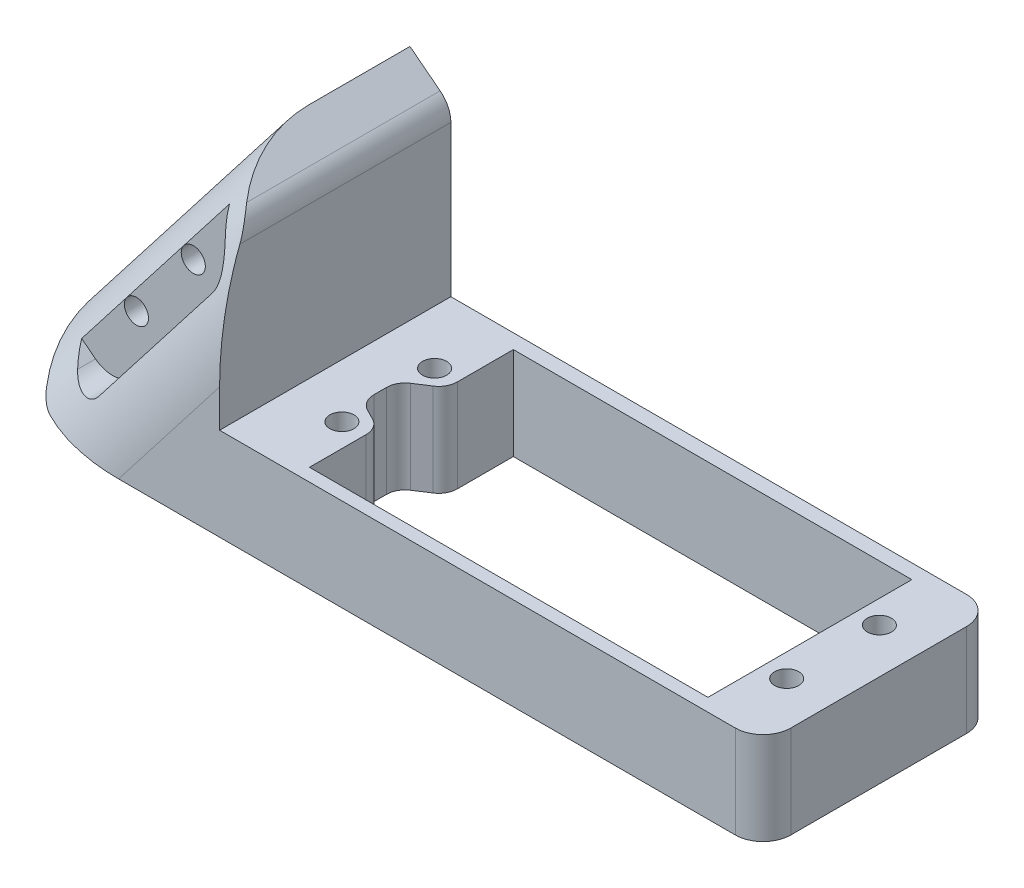
from build123d import *

# Parameters (mm, degrees)
CROQUIS1_W                        = 57
CROQUIS1_H                        = 24.959470006
CROQUIS1_W_2                      = 43
CROQUIS1_H_2                      = 22
MAIN_DEPTH                        = 28
CORTE_CAJA_REACH                  = 56.604
CROQUIS2_W                        = 27.955905163
CROQUIS2_H                        = 20.987971864
CROQUIS3_W                        = 32
CROQUIS3_H                        = 24.959470006
SALIENTE_EXTRUIR2_DEPTH           = 2.25
REDONDEO_LATERALES_R              = 3
CROQUIS7_R                        = 1.3
TALADROS_BASE_DEPTH               = 11
CAJEADO_CABLE_DEPTH               = 10
CAJEADO_REDONDEO_R                = 2
SOPORTE_EN_ANGULO_DEPTH           = 24.959470007
CAJA_PARA_SOPORTE_DEPTH           = 11
CROQUIS12_R                       = 1.3
TALADROS_CAJA_SOPORTE_DEPTH       = 13.959470007
CROQUIS15_W                       = 60.00042655
CROQUIS15_H                       = 27.426571923
RECORTE_CAJA_DEPTH                = 24.959470007
CHAFLAN_SUPERIOR_SOPORTE_DEPTH    = 24.959470007
REDONDEO_ARISTAS_SOPORTE_R        = 3
REDONDEO_SOPORTE_R                = 14
CROQUIS17_W                       = 6.155207263
CROQUIS17_H                       = 26
CAJA_TORNILLOS_SOPORTE_DEPTH      = 8
REDONDEO_CAJA_TORNILLOS_SOPORTE_R = 3


with BuildPart() as part:
    # Croquis1 → Main (new body)
    with BuildSketch(Plane(origin=(0, 0, 0), x_dir=(1, 0, 0), z_dir=(0, 1, 0))):
        with Locations((11.181999645, 13.428246359)):
            Rectangle(CROQUIS1_W, CROQUIS1_H)
        with Locations((10.844499645, 13.338562849)):
            Rectangle(CROQUIS1_W_2, CROQUIS1_H_2, mode=Mode.SUBTRACT)
    extrude(amount=MAIN_DEPTH)

    # Corte Caja: up to this face of the body (flat: up to its plane)
    corte_caja_end = Plane(part.part.faces().sort_by_distance((11.181999645, 14, -25.907981362))[0])
    # Croquis2 → Corte Caja (cut, up to the picked face)
    with BuildSketch(Plane.XY.offset(-0.948511356), mode=Mode.PRIVATE) as corte_caja_sk1:
        with Locations((28.659952227, 20.493985932)):
            Rectangle(CROQUIS2_W, CROQUIS2_H)
    corte_caja_tool1 = split(extrude(corte_caja_sk1.sketch, amount=-CORTE_CAJA_REACH, mode=Mode.PRIVATE), bisect_by=corte_caja_end, keep=Keep.BOTH, mode=Mode.PRIVATE)
    add(corte_caja_tool1.solids().sort_by(Axis((28.659952, 20.493986, -0.948511), (0, 0, -1)))[0], mode=Mode.SUBTRACT)

    # Croquis3 → Saliente-Extruir2 (add)
    with BuildSketch(Plane(origin=(0, 28, 0), x_dir=(1, 0, 0), z_dir=(0, 1, 0))):
        with Locations((-1.318000355, 13.428246359)):
            Rectangle(CROQUIS3_W, CROQUIS3_H)
    extrude(amount=SALIENTE_EXTRUIR2_DEPTH)

    # Redondeo Laterales
    redondeo_laterales_edges = [part.edges().sort_by_distance(p)[0] for p in [
        (39.681999645, 5, -25.907981362),
        (39.681999645, 5, -0.948511356),
    ]]
    fillet(redondeo_laterales_edges, radius=REDONDEO_LATERALES_R)

    # Croquis7 → Taladros Base (cut)
    with BuildSketch(Plane.XZ):
        with Locations(Location((-13.155500355, -8.338562849, 0), (0, 0, 270))):
            Circle(CROQUIS7_R)
        with Locations(Location((-13.155500355, -18.338562849, 0), (0, 0, 270))):
            Circle(CROQUIS7_R)
        with Locations(Location((34.844499645, -8.338562849, 0), (0, 0, 270))):
            Circle(CROQUIS7_R)
        with Locations(Location((34.844499645, -18.338562849, 0), (0, 0, 270))):
            Circle(CROQUIS7_R)
    extrude(amount=-TALADROS_BASE_DEPTH, mode=Mode.SUBTRACT)

    # Croquis8 → Cajeado cable (cut)
    with BuildSketch(Plane.XZ):
        Polygon((-10.655500355, -17.197519433), (-10.655500355, -9.671098091), (-13.962983419, -11.385752006), (-13.962983419, -15.059503242), align=None)
    extrude(amount=-CAJEADO_CABLE_DEPTH, mode=Mode.SUBTRACT)

    # Cajeado Redondeo
    cajeado_redondeo_edges = [part.edges().sort_by_distance(p)[0] for p in [
        (-13.962983419, 5, -11.385752006),
        (-10.655500355, 5, -9.671098091),
        (-10.655500355, 5, -17.197519433),
        (-13.962983419, 5, -15.059503242),
    ]]
    fillet(cajeado_redondeo_edges, radius=CAJEADO_REDONDEO_R)

    # Croquis10 → Soporte en angulo (add)
    with BuildSketch(Plane.XY.offset(-0.948511356)):
        Polygon((-17.318000355, 30.25), (-17.318000355, 0), (-40.697936457, 0), (-44.719041018, 3.698501078), (-22.354269001, 32.502718411), (-18.018493057, 32.502718411), align=None)
    extrude(amount=-SOPORTE_EN_ANGULO_DEPTH)

    # Croquis11 → Caja para soporte (cut)
    with BuildSketch(Plane(origin=(0, 0, -25.907981362), x_dir=(-1, 0, 0), z_dir=(0, 0, -1))):
        with BuildLine():
            Line((41.509326916, 7.83238192), (25.563983103, 28.36883757))
            Line((25.563983103, 28.36883757), (21.614664709, 25.302425298))
            ThreePointArc((21.614664709, 25.302425298), (20.477989634, 23.307419605), (21.084921035, 21.092986898))
            Line((21.084921035, 21.092986898), (33.350570122, 5.295713321))
            ThreePointArc((33.350570122, 5.295713321), (35.345575815, 4.159038247), (37.560008522, 4.765969648))
            Line((37.560008522, 4.765969648), (41.509326916, 7.83238192))
        make_face()
    extrude(amount=-CAJA_PARA_SOPORTE_DEPTH, mode=Mode.SUBTRACT)

    # Croquis12 → Taladros caja soporte (cut)
    with BuildSketch(Plane(origin=(0, 0, -14.907981362), x_dir=(-1, 0, 0), z_dir=(0, 0, -1))):
        with Locations((27.011052418, 19.330608197)):
            Circle(CROQUIS12_R)
        with Locations((33.143876962, 11.431971409)):
            Circle(CROQUIS12_R)
    extrude(amount=-TALADROS_CAJA_SOPORTE_DEPTH, mode=Mode.SUBTRACT)

    # Croquis15 → Recorte Caja (cut)
    with BuildSketch(Plane.XY.offset(-0.948511356)):
        with Locations((11.033774869, 23.713285962)):
            Rectangle(CROQUIS15_W, CROQUIS15_H)
    extrude(amount=-RECORTE_CAJA_DEPTH, mode=Mode.SUBTRACT)

    # Croquis16 → Chaflan superior soporte (cut)
    with BuildSketch(Plane(origin=(0, 0, -25.907981362), x_dir=(-1, 0, 0), z_dir=(0, 0, -1))):
        Polygon((26.059899943, 33.268736427), (17.368016439, 26.520002701), (17.368016439, 33.268736427), align=None)
    extrude(amount=-CHAFLAN_SUPERIOR_SOPORTE_DEPTH, mode=Mode.SUBTRACT)

    # Redondeo aristas soporte
    redondeo_aristas_soporte_edges = [part.edges().sort_by_distance(p)[0] for p in [
        (-40.697936457, 0, -13.428246359),
        (-18.966438406, 27.761082869, -13.428246359),
    ]]
    fillet(redondeo_aristas_soporte_edges, radius=REDONDEO_ARISTAS_SOPORTE_R)

    # Redondeo soporte
    # the kernel refuses this fillet: 14 mm, written as the material it takes off along each edge
    with BuildSketch(Plane(origin=(-66.183926921, -23.946727682, -0.948511356), x_dir=(0.7898636788540391, -0.6132824543610909, 0), z_dir=(0.6132824543610909, 0.7898636788540392, 0))) as redondeo_soporte_piece_1:
        with BuildLine():
            CenterArc((REDONDEO_SOPORTE_R, REDONDEO_SOPORTE_R), REDONDEO_SOPORTE_R, 180, 90)
            Line((0, REDONDEO_SOPORTE_R), (0, 0))
            Line((0, 0), (REDONDEO_SOPORTE_R, 0))
        make_face()
    extrude(amount=104.799778712, mode=Mode.SUBTRACT)

    # Croquis17 → Caja tornillos soporte (cut)
    with BuildSketch(Plane(origin=(-29.691111601, 23.053392988, 0), x_dir=(0, 0, 1), z_dir=(-0.789863678854039, 0.6132824543610911, 0))):
        with Locations((-3.077603632, -6.270427893)):
            Rectangle(CROQUIS17_W, CROQUIS17_H)
    extrude(amount=-CAJA_TORNILLOS_SOPORTE_DEPTH, mode=Mode.SUBTRACT)

    # redondeo Caja tornillos soporte
    redondeo_caja_tornillos_soporte_edges = [part.edges().sort_by_distance(p)[0] for p in [
        (-35.190417485, 2.926122285, -4.227303989),
        (-19.245073672, 23.462577935, -4.227303989),
    ]]
    fillet(redondeo_caja_tornillos_soporte_edges, radius=REDONDEO_CAJA_TORNILLOS_SOPORTE_R)


solid = part.part
